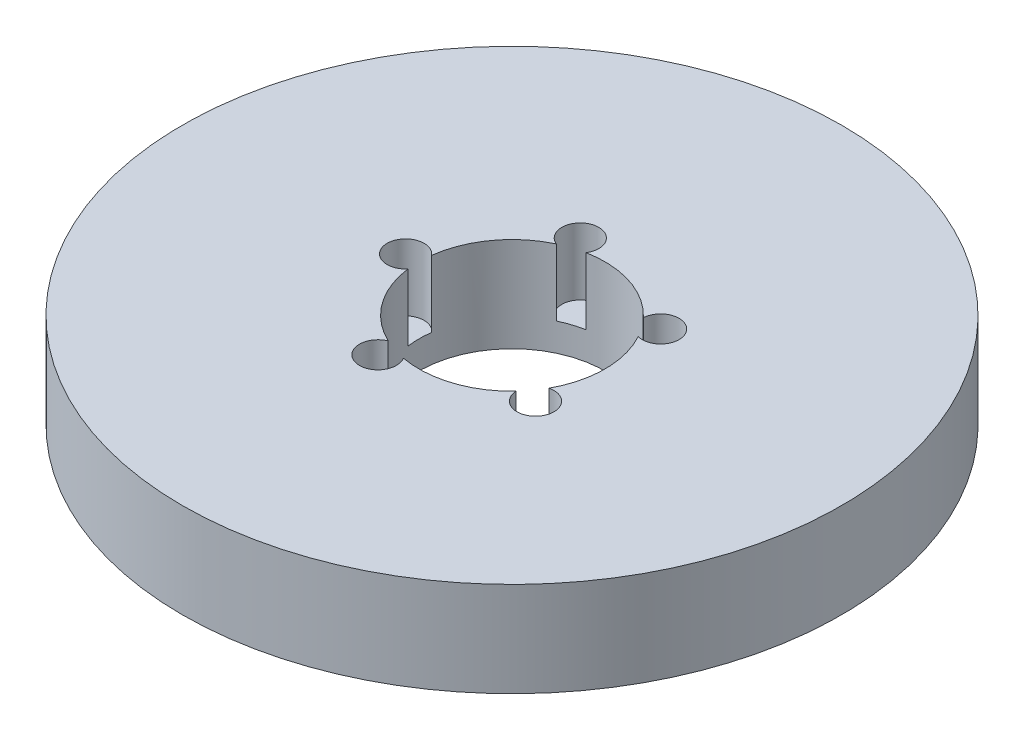
from build123d import *

# Parameters (mm, degrees)
SKETCH1_R           = 97.5
BOSS_EXTRUDE1_DEPTH = 28
SKETCH2_R           = 27.5
CUT_EXTRUDE1_DEPTH  = 141.700035537
SKETCH3_R           = 5.464481516
CUT_EXTRUDE2_DEPTH  = 19.750131391
CIRPATTERN1_COUNT   = 5


with BuildPart() as part:
    # Sketch1 → Boss-Extrude1 (new body)
    with BuildSketch(Plane(origin=(0, 0, 0), x_dir=(1, 0, 0), z_dir=(0, 1, 0))):
        Circle(SKETCH1_R)
    extrude(amount=BOSS_EXTRUDE1_DEPTH)

    # Sketch2 → Cut-Extrude1 (cut, through all)
    with BuildSketch(Plane(origin=(0, 0, 0), x_dir=(1, 0, 0), z_dir=(0, 1, 0))):
        Circle(SKETCH2_R)
    extrude(amount=CUT_EXTRUDE1_DEPTH, mode=Mode.SUBTRACT)

    # Sketch3 → Cut-Extrude2 (cut)
    with BuildSketch(Plane(origin=(0, 28, 0), x_dir=(1, 0, 0), z_dir=(0, 1, 0))):
        with Locations((-31.475121573, 0)):
            Circle(SKETCH3_R)
    cut_extrude2 = extrude(amount=-CUT_EXTRUDE2_DEPTH, mode=Mode.SUBTRACT)

    # CirPattern1: Cut-Extrude2 ×5 about axis
    cirpattern1_axis = Axis((0, 0, 0), (0, 1, 0))
    for i in range(1, CIRPATTERN1_COUNT):
        add(cut_extrude2.rotate(cirpattern1_axis, i * 360 / CIRPATTERN1_COUNT), mode=Mode.SUBTRACT)


solid = part.part
